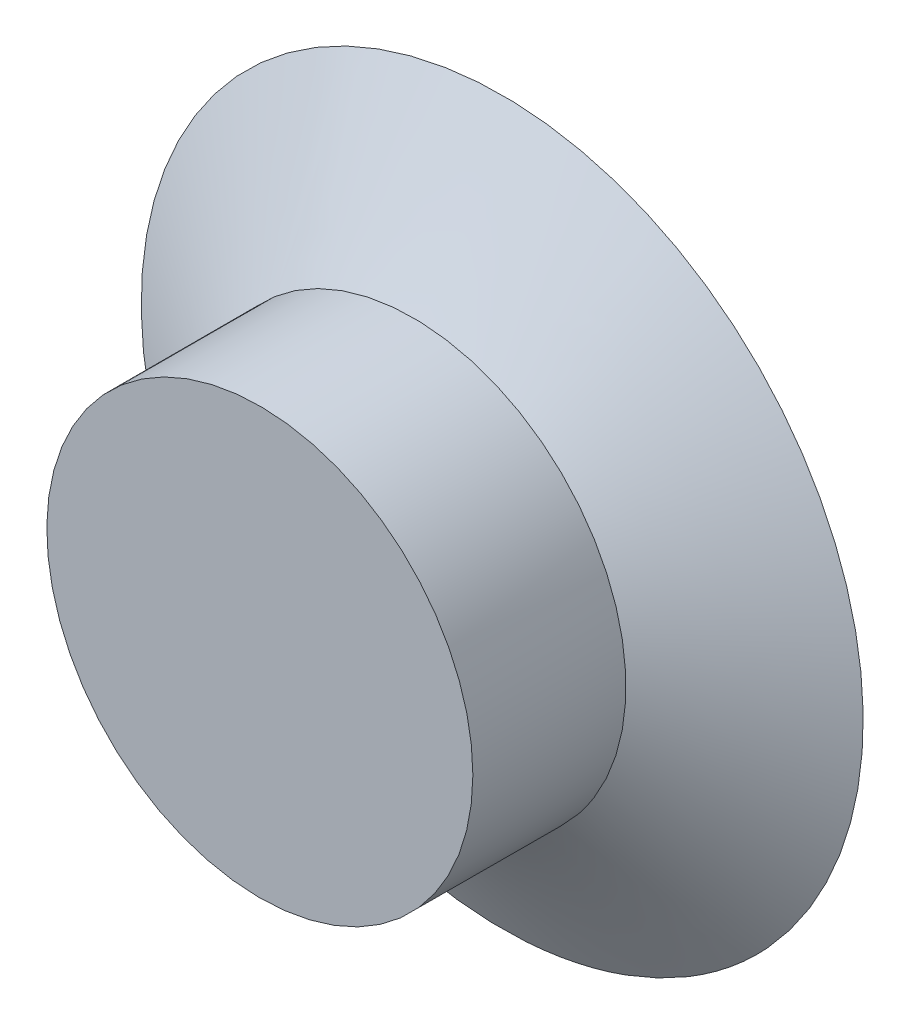
from build123d import *

# Parameters (mm, degrees)
SKETCH2_R           = 16.7
BOSS_EXTRUDE1_DEPTH = 12


with BuildPart() as part:
    # Sketch2 → Boss-Extrude1 (new body)
    with BuildSketch(Plane.XY.offset(7)):
        Circle(SKETCH2_R)
    extrude(amount=BOSS_EXTRUDE1_DEPTH)

    # Loft1: read off the stored shape, not the designer's step
    # Loft1: loft between two sections, ruled curve by curve
    loft1_from = [
        Edge.make_bspline([(-10.845782407, 12.698779626, 7), (14.551776844, 34.39034444, 7), (36.243341658, 8.992785189, 7), (10.845782407, -12.698779626, 7), (-14.551776844, -34.39034444, 7), (-36.243341658, -8.992785189, 7), (-10.845782407, 12.698779626, 7)], [0, 0, 0, 0, 0.5, 0.5, 0.5, 1, 1, 1, 1], 3, [1, 0.333333333, 0.333333333, 1, 0.333333333, 0.333333333, 1]),
    ]
    loft1_to = [
        Edge.make_bspline([(-12.210206093, 25.53039105, 0), (38.850576007, 49.950803236, 0), (63.270988193, -1.109978865, 0), (12.210206093, -25.53039105, 0), (-38.850576007, -49.950803236, 0), (-63.270988193, 1.109978865, 0), (-12.210206093, 25.53039105, 0)], [0, 0, 0, 0, 0.5, 0.5, 0.5, 1, 1, 1, 1], 3, [1, 0.333333333, 0.333333333, 1, 0.333333333, 0.333333333, 1]),
    ]
    loft1 = Solid(Shell([*[Face.make_surface_from_curves(loft1_from[k], loft1_to[k]) for k in range(1)], Face(Wire(loft1_from)), Face(Wire(loft1_to))]))
    add(loft1)


solid = part.part
